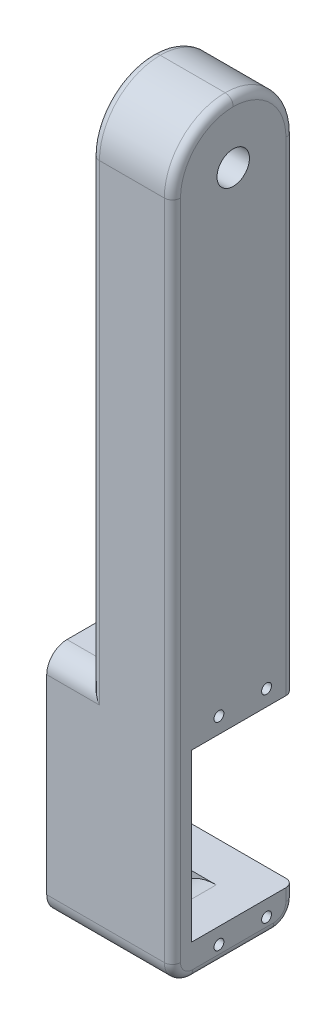
from build123d import *

# Parameters (mm, degrees)
SKETCH1_W                 = 20
SKETCH1_H                 = 30
BOSS_EXTRUDE1_DEPTH       = 183.3
SKETCH13_W                = 30
SKETCH13_H                = 57
BOSS_EXTRUDE2_DEPTH       = 11
SKETCH3_W                 = 20.6
SKETCH3_H                 = 41
CUT_EXTRUDE1_DEPTH        = 40
SKETCH11_R                = 10.5
CUT_EXTRUDE4_DEPTH        = 2.4
SKETCH12_R                = 4
CUT_EXTRUDE5_DEPTH        = 185.752943143
SKETCH14_W                = 31
SKETCH14_H                = 41
CUT_EXTRUDE6_DEPTH        = 25.3
F_2_CLEARANCE_HOLE2_D     = 2.4384
F_2_CLEARANCE_HOLE2_DEPTH = 6.35
F_2_CLEARANCE_HOLE2_TIP   = 0.732569267
CUT_EXTRUDE8_START        = -2
CUT_EXTRUDE8_DEPTH        = 1.6
F_2_CLEARANCE_HOLE3_D     = 2.4384
F_2_CLEARANCE_HOLE3_DEPTH = 6.35
F_2_CLEARANCE_HOLE3_TIP   = 1.2192
FILLET3_R                 = 15
FILLET4_R                 = 5
FILLET5_R                 = 2
SKETCH21_W                = 6
SKETCH21_H                = 10
CUT_EXTRUDE9_DEPTH        = 8
FILLET6_R                 = 12
FILLET7_R                 = 6
CUT_EXTRUDE10_START       = -2
CUT_EXTRUDE10_DEPTH       = 1.8


# Some blends are built 0.0001 mm under size
with BuildPart() as part:
    # Sketch1 → Boss-Extrude1 (new body)
    with BuildSketch(Plane(origin=(0, 0, 0), x_dir=(1, 0, 0), z_dir=(0, 1, 0))):
        Rectangle(SKETCH1_W, SKETCH1_H)
    extrude(amount=BOSS_EXTRUDE1_DEPTH)

    # Sketch13 → Boss-Extrude2 (add)
    with BuildSketch(Plane.ZY.offset(10)):
        with Locations((0, 28.5)):
            Rectangle(SKETCH13_W, SKETCH13_H)
    extrude(amount=BOSS_EXTRUDE2_DEPTH)

    # Sketch3 → Cut-Extrude1 (cut)
    with BuildSketch(Plane(origin=(10, 0, 0), x_dir=(0, 0, -1), z_dir=(1, 0, 0))):
        with Locations((0, 28.5)):
            Rectangle(SKETCH3_W, SKETCH3_H)
    extrude(amount=-CUT_EXTRUDE1_DEPTH, mode=Mode.SUBTRACT)

    # Sketch11 → Cut-Extrude4 (cut)
    with BuildSketch(Plane.ZY.offset(10)):
        with Locations((0, 168.3)):
            Circle(SKETCH11_R)
    extrude(amount=-CUT_EXTRUDE4_DEPTH, mode=Mode.SUBTRACT)

    # Sketch12 → Cut-Extrude5 (cut, through all)
    with BuildSketch(Plane.ZY.offset(7.6)):
        with Locations((0, 168.3)):
            Circle(SKETCH12_R)
    extrude(amount=-CUT_EXTRUDE5_DEPTH, mode=Mode.SUBTRACT)

    # Sketch14 → Cut-Extrude6 (cut)
    with BuildSketch(Plane(origin=(0, 0, -15), x_dir=(-1, 0, 0), z_dir=(0, 0, -1))):
        with Locations((5.5, 28.5)):
            Rectangle(SKETCH14_W, SKETCH14_H)
    extrude(amount=-CUT_EXTRUDE6_DEPTH, mode=Mode.SUBTRACT)

    # #2 Clearance Hole2
    with Locations(Plane.ZY.offset(21)):
        with Locations((-9.5, 5), (7.5, 5), (-9.5, 52), (7.5, 52)):
            Hole(F_2_CLEARANCE_HOLE2_D / 2, depth=F_2_CLEARANCE_HOLE2_DEPTH)
            with Locations((0, 0, -(F_2_CLEARANCE_HOLE2_DEPTH + F_2_CLEARANCE_HOLE2_TIP / 2))):  # 118° drill point
                Cone(0, F_2_CLEARANCE_HOLE2_D / 2, F_2_CLEARANCE_HOLE2_TIP, mode=Mode.SUBTRACT)

    # Sketch18 → Cut-Extrude8 (cut)
    with BuildSketch(Plane.ZY.offset(21).offset(CUT_EXTRUDE8_START)):
        Polygon((-12.329016319, 5), (-10.91450816, 2.55), (-8.08549184, 2.55), (-6.670983681, 5), (-8.08549184, 7.45), (-10.91450816, 7.45), align=None)
        Polygon((10.329016319, 5), (8.91450816, 7.45), (6.08549184, 7.45), (4.670983681, 5), (6.08549184, 2.55), (8.91450816, 2.55), align=None)
        Polygon((4.670983681, 52), (6.08549184, 49.55), (8.91450816, 49.55), (10.329016319, 52), (8.91450816, 54.45), (6.08549184, 54.45), align=None)
        Polygon((-6.670983681, 52), (-8.08549184, 54.45), (-10.91450816, 54.45), (-12.329016319, 52), (-10.91450816, 49.55), (-8.08549184, 49.55), align=None)
    extrude(amount=-CUT_EXTRUDE8_DEPTH, mode=Mode.SUBTRACT)

    # #2 Clearance Hole3
    with Locations(Plane(origin=(10, 0, 0), x_dir=(0, 0, -1), z_dir=(1, 0, 0))):
        with Locations((8.22, 4.1), (-3.52, 4.1), (-3.52, 52.9), (8.22, 52.9)):
            Hole(F_2_CLEARANCE_HOLE3_D / 2, depth=F_2_CLEARANCE_HOLE3_DEPTH)
            with Locations((0, 0, -(F_2_CLEARANCE_HOLE3_DEPTH + F_2_CLEARANCE_HOLE3_TIP / 2))):  # 90° drill point
                Cone(0, F_2_CLEARANCE_HOLE3_D / 2, F_2_CLEARANCE_HOLE3_TIP, mode=Mode.SUBTRACT)

    # Fillet3
    fillet3_edges = [part.edges().sort_by_distance(p)[0] for p in [
        (0, 183.3, -15),
        (0, 183.3, 15),
    ]]
    fillet(fillet3_edges, radius=FILLET3_R - 0.0001)  # a hair under: the kernel refuses the full size

    # Fillet4
    fillet4_edges = [part.edges().sort_by_distance(p)[0] for p in [
        (-15.5, 57, -15),
        (-15.5, 57, 15),
        (-5.5, 0, -15),
        (-5.5, 0, 15),
    ]]
    fillet(fillet4_edges, radius=FILLET4_R)

    # Fillet5
    fillet5_edges = [part.edges().sort_by_distance(p)[0] for p in [
        (-10, 110.15005, 15),
        (-10, 110.15005, -15),
        (-10, 178.906631007, 10.606631007),
        (-10, 178.906631007, -10.606631007),
        (10, 108.65005, -15),
        (10, 86.65005, 15),
        (10, 178.906631007, 10.606631007),
        (10, 178.906631007, -10.606631007),
        (10, 0, 0),
        (10, 1.464466094, 13.535533906),
        (10, 1.464466094, -13.535533906),
        (10, 6.5, -15),
    ]]
    fillet(fillet5_edges, radius=FILLET5_R)

    # Sketch21 → Cut-Extrude9 (cut)
    with BuildSketch(Plane.XZ):
        with Locations((-13.5, 0)):
            Rectangle(SKETCH21_W, SKETCH21_H)
    extrude(amount=-CUT_EXTRUDE9_DEPTH, mode=Mode.SUBTRACT)

    # Fillet6
    # the kernel refuses this fillet: 12 mm, written as the material it takes off along each edge
    with BuildSketch(Plane(origin=(-10.5, 8, -5), x_dir=(1, 0, 0), z_dir=(0, 0, 1))) as fillet6_piece_1:
        with BuildLine():
            CenterArc((11.313708499, -12), FILLET6_R, 90, 70.528779366)
            Line((0, -8), (0, 0))
            Line((0, 0), (11.313708499, 0))
        make_face()
    extrude(amount=10, mode=Mode.SUBTRACT)

    # Fillet7
    # the kernel refuses this fillet: 6 mm, written as the material it takes off along each edge
    with BuildSketch(Plane(origin=(4.5, 0, 5), x_dir=(0, 1, 0), z_dir=(-1, 0, 0))) as fillet7_piece_1_section:
        with BuildLine():
            CenterArc((FILLET7_R, -FILLET7_R), FILLET7_R, 90, 90)
            Line((0, -FILLET7_R), (0, 0))
            Line((0, 0), (FILLET7_R, 0))
        make_face()
    fillet7_piece_1 = extrude(amount=21, mode=Mode.PRIVATE)
    fillet7_piece_1 = fillet7_piece_1 - Plane(origin=(0.813708499, -4, 5), x_dir=(1, 0, 0), z_dir=(0, 0, -1)) * Cylinder(12, 66, mode=Mode.PRIVATE)
    add(fillet7_piece_1, mode=Mode.SUBTRACT)

    # Sketch22 → Cut-Extrude10 (cut)
    with BuildSketch(Plane(origin=(10, 0, 0), x_dir=(0, 0, -1), z_dir=(1, 0, 0)).offset(CUT_EXTRUDE10_START)):
        Polygon((-6.349016319, 52.9), (-4.93450816, 50.45), (-2.10549184, 50.45), (-0.690983681, 52.9), (-2.10549184, 55.35), (-4.93450816, 55.35), align=None)
        Polygon((5.390983681, 52.9), (6.80549184, 50.45), (9.63450816, 50.45), (11.049016319, 52.9), (9.63450816, 55.35), (6.80549184, 55.35), align=None)
        Polygon((-6.349016319, 4.1), (-4.93450816, 1.65), (-2.10549184, 1.65), (-0.690983681, 4.1), (-2.10549184, 6.55), (-4.93450816, 6.55), align=None)
        Polygon((5.390983681, 4.1), (6.80549184, 1.65), (9.63450816, 1.65), (11.049016319, 4.1), (9.63450816, 6.55), (6.80549184, 6.55), align=None)
    extrude(amount=-CUT_EXTRUDE10_DEPTH, mode=Mode.SUBTRACT)


solid = part.part
